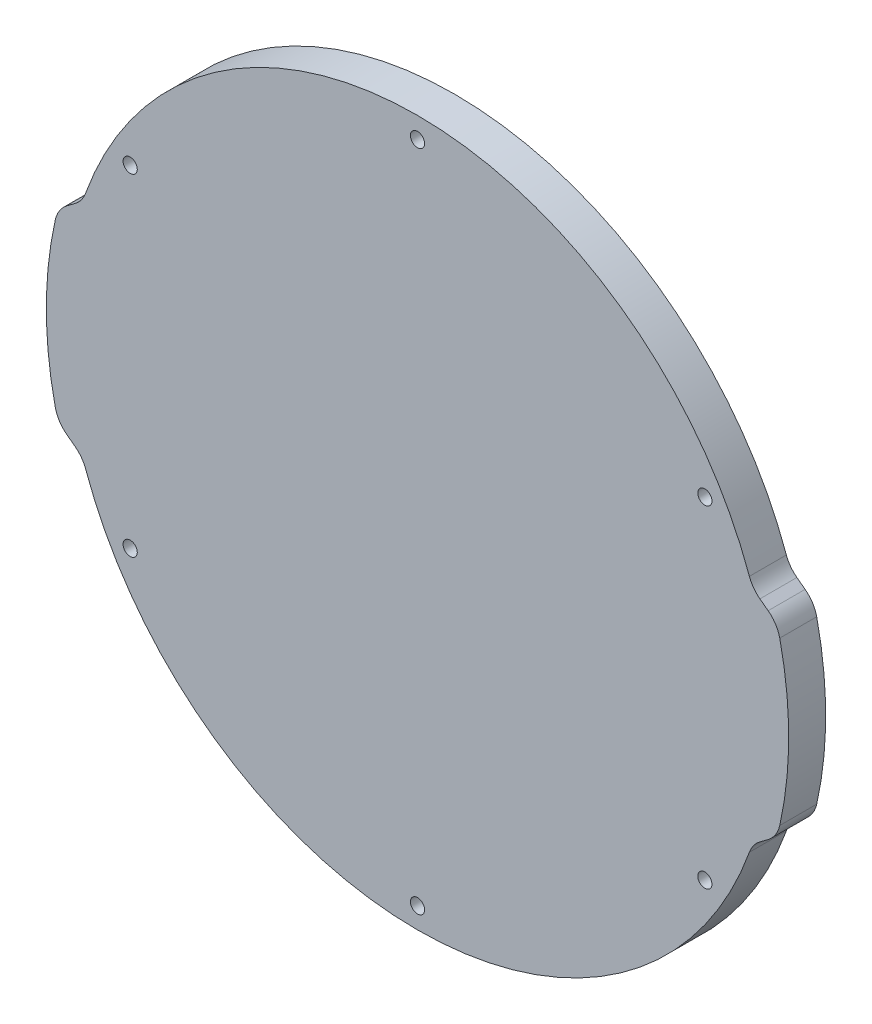
from build123d import *

# Parameters (mm, degrees)
ESQUISSE1_R        = 1.15
BOSS_EXTRU_1_DEPTH = 6
CONG_1_R           = 5


with BuildPart() as part:
    # Esquisse1 → Boss.-Extru.1 (new body)
    with BuildSketch(Plane.XY):
        with BuildLine():
            Line((-58.352913381, 15), (-54.346688032, 18))
            ThreePointArc((-54.346688032, 18), (0, 57.25), (54.346688032, 18))
            Line((54.346688032, 18), (58.352913381, 15))
            ThreePointArc((58.352913381, 15), (60.25, 0), (58.352913381, -15))
            Line((58.352913381, -15), (54.346688032, -18))
            ThreePointArc((54.346688032, -18), (0, -57.25), (-54.346688032, -18))
            Line((-54.346688032, -18), (-58.352913381, -15))
            ThreePointArc((-58.352913381, -15), (-60.25, 0), (-58.352913381, 15))
        make_face()
        with Locations((0, 53.85)):
            Circle(ESQUISSE1_R, mode=Mode.SUBTRACT)
        with Locations((46.635467994, 26.925)):
            Circle(ESQUISSE1_R, mode=Mode.SUBTRACT)
        with Locations((46.635467994, -26.925)):
            Circle(ESQUISSE1_R, mode=Mode.SUBTRACT)
        with Locations((0, -53.85)):
            Circle(ESQUISSE1_R, mode=Mode.SUBTRACT)
        with Locations((-46.635467994, -26.925)):
            Circle(ESQUISSE1_R, mode=Mode.SUBTRACT)
        with Locations((-46.635467994, 26.925)):
            Circle(ESQUISSE1_R, mode=Mode.SUBTRACT)
    extrude(amount=BOSS_EXTRU_1_DEPTH)

    # Congé1
    cong_1_edges = [part.edges().sort_by_distance(p)[0] for p in [
        (-54.346688032, 18, 3),
        (-58.352913381, 15, 3),
        (-58.352913381, -15, 3),
        (-54.346688032, -18, 3),
        (54.346688032, -18, 3),
        (58.352913381, -15, 3),
        (58.352913381, 15, 3),
        (54.346688032, 18, 3),
    ]]
    fillet(cong_1_edges, radius=CONG_1_R)


solid = part.part
